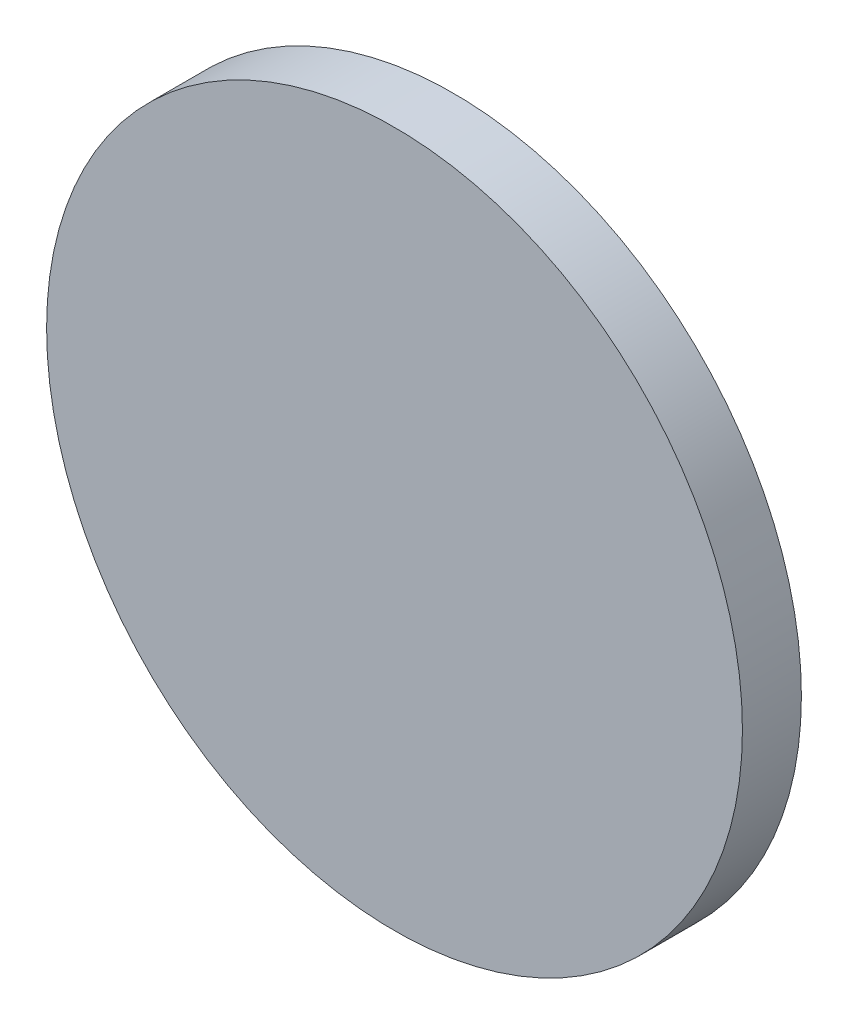
from build123d import *

# Parameters (mm, degrees)
SKETCH1_R           = 58.998448378
BOSS_EXTRUDE1_DEPTH = 10


with BuildPart() as part:
    # Sketch1 → Boss-Extrude1 (new body)
    with BuildSketch(Plane.XY):
        Circle(SKETCH1_R)
    extrude(amount=BOSS_EXTRUDE1_DEPTH)


solid = part.part
